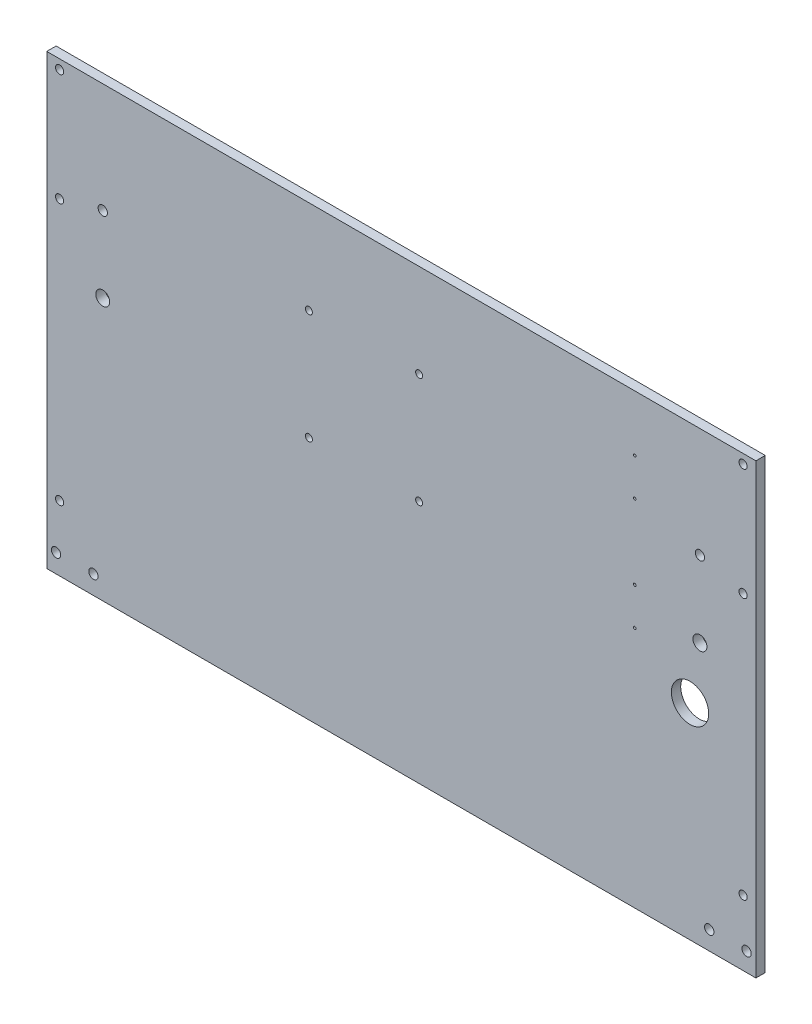
from build123d import *

# Parameters (mm, degrees)
SKETCH1_W           = 482.6
SKETCH1_H           = 304.8
BOSS_EXTRUDE1_DEPTH = 6.35
SKETCH2_R           = 2.7813
CUT_EXTRUDE1_DEPTH  = 286.467638271
SKETCH3_R           = 3.175
CUT_EXTRUDE2_DEPTH  = 286.467638271
SKETCH4_R           = 12.7
CUT_EXTRUDE3_DEPTH  = 286.467638271
SKETCH5_R           = 2.3749
CUT_EXTRUDE4_DEPTH  = 286.467638271
SKETCH6_R           = 3.175
SKETCH6_R_2         = 4.7625
CUT_EXTRUDE5_DEPTH  = 286.467638271
SKETCH7_R           = 0.889
CUT_EXTRUDE6_DEPTH  = 286.467638271


with BuildPart() as part:
    # Sketch1 → Boss-Extrude1 (new body)
    with BuildSketch(Plane.XY):
        Rectangle(SKETCH1_W, SKETCH1_H)
    extrude(amount=BOSS_EXTRUDE1_DEPTH)

    # Sketch2 → Cut-Extrude1 (cut, through all)
    with BuildSketch(Plane.XY.offset(6.35)):
        with Locations((-232.5624, 146.05)):
            Circle(SKETCH2_R)
        with Locations((-232.5624, -107.95)):
            Circle(SKETCH2_R)
        with Locations((-232.5624, 69.85)):
            Circle(SKETCH2_R)
    cut_extrude1 = extrude(amount=-CUT_EXTRUDE1_DEPTH, mode=Mode.SUBTRACT)

    # Mirror1: Cut-Extrude1 across plane
    add(cut_extrude1.mirror(Plane(origin=(0, 0, 0), x_dir=(0, 0, 1), z_dir=(1, 0, 0))), mode=Mode.SUBTRACT)

    # Sketch3 → Cut-Extrude2 (cut, through all)
    with BuildSketch(Plane.XY.offset(6.35)):
        with Locations((-234.95, -139.7)):
            Circle(SKETCH3_R)
        with Locations((-209.55, -139.7)):
            Circle(SKETCH3_R)
    cut_extrude2 = extrude(amount=-CUT_EXTRUDE2_DEPTH, mode=Mode.SUBTRACT)

    # Mirror2: Cut-Extrude2 across plane
    add(cut_extrude2.mirror(Plane(origin=(0, 0, 0), x_dir=(0, 0, 1), z_dir=(1, 0, 0))), mode=Mode.SUBTRACT)

    # Sketch4 → Cut-Extrude3 (cut, through all)
    with BuildSketch(Plane.XY.offset(6.35)):
        with Locations((196.469, -12.7)):
            Circle(SKETCH4_R)
    extrude(amount=-CUT_EXTRUDE3_DEPTH, mode=Mode.SUBTRACT)

    # Sketch5 → Cut-Extrude4 (cut, through all)
    with BuildSketch(Plane.XY.offset(6.35)):
        with Locations((-62.9, 88.9)):
            Circle(SKETCH5_R)
        with Locations((12.1, 88.9)):
            Circle(SKETCH5_R)
        with Locations((12.1, 13.9)):
            Circle(SKETCH5_R)
        with Locations((-62.9, 13.9)):
            Circle(SKETCH5_R)
    extrude(amount=-CUT_EXTRUDE4_DEPTH, mode=Mode.SUBTRACT)

    # Sketch6 → Cut-Extrude5 (cut, through all)
    with BuildSketch(Plane.XY.offset(6.35)):
        with Locations((-203.2, 77.727111167)):
            Circle(SKETCH6_R)
        with Locations((-203.2, 26.096105915)):
            Circle(SKETCH6_R_2)
        with Locations((203.2, 77.727111167)):
            Circle(SKETCH6_R)
        with Locations((203.2, 26.096105915)):
            Circle(SKETCH6_R_2)
    extrude(amount=-CUT_EXTRUDE5_DEPTH, mode=Mode.SUBTRACT)

    # Sketch7 → Cut-Extrude6 (cut, through all)
    with BuildSketch(Plane.XY.offset(6.35)):
        with Locations((158.821461806, 114.3)):
            Circle(SKETCH7_R)
        with Locations((158.821461806, 88.9)):
            Circle(SKETCH7_R)
        with Locations((158.821461806, 38.1)):
            Circle(SKETCH7_R)
        with Locations((158.821461806, 12.7)):
            Circle(SKETCH7_R)
    extrude(amount=-CUT_EXTRUDE6_DEPTH, mode=Mode.SUBTRACT)


solid = part.part
